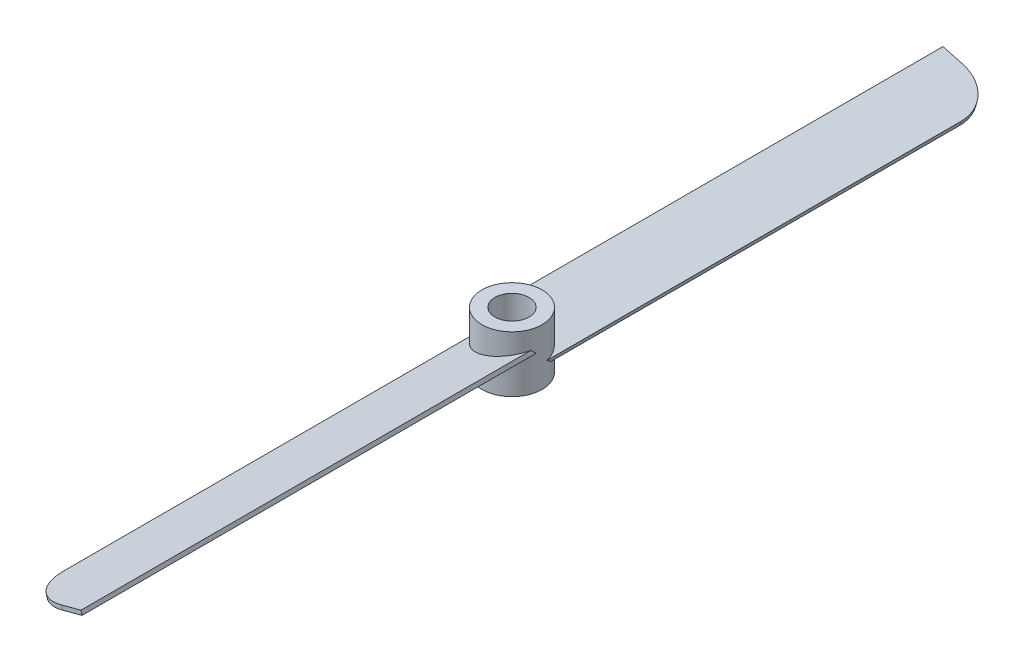
from build123d import *

# Parameters (mm, degrees)
SKETCH1_R           = 7.5
BOSS_EXTRUDE2_DEPTH = 14
CUT_EXTRUDE1_REACH  = 19.564
SKETCH2_R           = 4.25
BOSS_EXTRUDE3_START = -7.279118874
BOSS_EXTRUDE3_DEPTH = 1.03527618
FILLET1_R           = 10
CIRPATTERN1_COUNT   = 2
FILLET3_R           = 10


with BuildPart() as part:
    # Sketch1 → Boss-Extrude2 (new body)
    with BuildSketch(Plane(origin=(0, 0, 0), x_dir=(1, 0, 0), z_dir=(0, 1, 0))):
        with Locations(Location((0, 0, 0), (0, 0, 270))):
            Circle(SKETCH1_R)
    extrude(amount=BOSS_EXTRUDE2_DEPTH)

    # Sketch2 → Cut-Extrude1 (cut, up to next)
    with BuildSketch(Plane(origin=(0, 14, 0), x_dir=(1, 0, 0), z_dir=(0, 1, 0)), mode=Mode.PRIVATE) as cut_extrude1_sk1:
        with Locations(Location((0, 0, 0), (0, 0, 270))):
            Circle(SKETCH2_R)
    cut_extrude1_tool1 = extrude(cut_extrude1_sk1.sketch, amount=-CUT_EXTRUDE1_REACH, mode=Mode.PRIVATE) & part.part
    add(cut_extrude1_tool1.solids().sort_by_distance((0, 14, 0))[0], mode=Mode.SUBTRACT)

    # Boss-Extrude3: read off the stored shape, not the designer's step
    # Boss-Extrude3 outline → Boss-Extrude3 (add)
    with BuildSketch(Plane(origin=(0, 0, 0), x_dir=(0.9659258262890672, 0.2588190451025251, 0), z_dir=(0.25881904510252507, -0.9659258262890672, 0)).offset(BOSS_EXTRUDE3_START)):
        with BuildLine():
            add(Edge.make_bspline(
                [(-5.688266684, 1.344969698), (-4.547659305, 7.389056985), (1.811733316, 7.498803292)],
                knots=[0.18030465, 0.18030465, 0.18030465, 1.551469461, 1.551469461, 1.551469461], degree=2, weights=[1, 0.771122328, 0.993637519]))
            add(Edge.make_bspline(
                [(1.811733316, 7.498803292), (8.171125936, 7.389056985), (9.311733316, 1.344969698)],
                knots=[1.590123193, 1.590123193, 1.590123193, 2.961288004, 2.961288004, 2.961288004], degree=2, weights=[0.993637519, 0.771122328, 1]))
            Line((9.311733316, 1.344969698), (9.311733316, 114.5))
            Line((9.311733316, 114.5), (-5.688266684, 114.5))
            Line((-5.688266684, 114.5), (-5.688266684, 1.344969698))
        make_face()
    boss_extrude3 = extrude(amount=BOSS_EXTRUDE3_DEPTH)

    # Fillet1
    fillet1_edges = [part.edges().sort_by_distance(p)[0] for p in [
        (-7.244443697, 5.058857162, 114.5),
    ]]
    fillet(fillet1_edges, radius=FILLET1_R)

    # CirPattern1: Boss-Extrude3 ×2 about axis
    cirpattern1_axis = Axis((0, 0, 0), (0, 1, 0))
    for i in range(1, CIRPATTERN1_COUNT):
        add(boss_extrude3.rotate(cirpattern1_axis, i * 360 / CIRPATTERN1_COUNT))

    # Fillet3
    fillet3_edges = [part.edges().sort_by_distance(p)[0] for p in [
        (7.244443697, 5.058857162, -114.5),
    ]]
    fillet(fillet3_edges, radius=FILLET3_R)


solid = part.part
